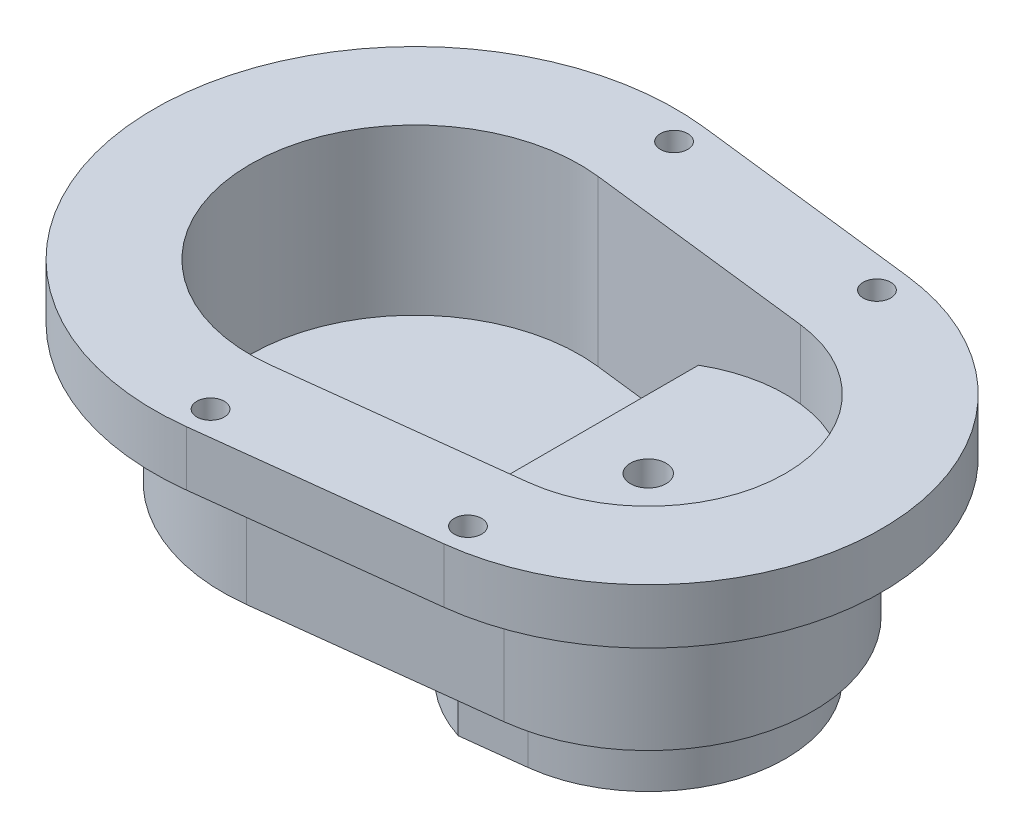
from build123d import *

# Parameters (mm, degrees)
EXTRUDE_2_DEPTH     = 70
CUT_EXTRUDE_1_DEPTH = 90
EXTRUDE_3_OUTLINE_R = 45
EXTRUDE_3_DEPTH     = 20
EXTRUDE_START       = -10
EXTRUDE_4_DEPTH     = 10
EXTRUDE_START_2     = -20
EXTRUDE_5_DEPTH     = 20
CUT_EXTRUDE_2_DEPTH = 207.942020866
EXTRUDE_START_3     = 35
SKETCH_13_R         = 50
EXTRUDE_6_DEPTH     = 35
CUT_EXTRUDE_START   = 15
CUT_EXTRUDE_3_DEPTH = 15
SKETCH_15_R         = 6.5
CUT_EXTRUDE_4_DEPTH = 207.942020866
CUT_EXTRUDE_5_REACH = 207.305


# Read off the part's stored shape, not the designer's step: 凸台-拉伸3
with BuildPart() as part:
    # 草图1 → 凸台-拉伸2 (new body)
    with BuildSketch(Plane(origin=(0, 0, 0), x_dir=(1, 0, 0), z_dir=(0, 1, 0))):
        with BuildLine():
            Line((8.235294118, 69.513883008), (92.058823529, 59.583328292))
            ThreePointArc((92.058823529, 59.583328292), (145, 0), (92.058823529, -59.583328292))
            Line((92.058823529, -59.583328292), (8.235294118, -69.513883008))
            ThreePointArc((8.235294118, -69.513883008), (-70, 0), (8.235294118, 69.513883008))
        make_face()
    extrude(amount=EXTRUDE_2_DEPTH)

    # 草图2 → 切除-拉伸1 (cut)
    with BuildSketch(Plane(origin=(0, 70, 0), x_dir=(1, 0, 0), z_dir=(0, 1, 0))):
        with BuildLine():
            Line((7.058823529, -59.583328292), (90.882352941, -49.652773577))
            ThreePointArc((90.882352941, -49.652773577), (135, 0), (90.882352941, 49.652773577))
            Line((90.882352941, 49.652773577), (7.058823529, 59.583328292))
            ThreePointArc((7.058823529, 59.583328292), (-60, 0), (7.058823529, -59.583328292))
        make_face()
    extrude(amount=-CUT_EXTRUDE_1_DEPTH, mode=Mode.SUBTRACT)



with BuildPart() as body_2:
    # 凸台-拉伸3 outline → 凸台-拉伸3 (new body)
    with BuildSketch(Plane.XZ):
        with BuildLine():
            ThreePointArc((90.882352941, -49.652773577), (135, 0), (90.882352941, 49.652773577))
            Line((90.882352941, 49.652773577), (68.128593603, 52.348406339))
            ThreePointArc((68.128593603, 52.348406339), (30, 0), (68.128593603, -52.348406339))
            Line((68.128593603, -52.348406339), (90.882352941, -49.652773577))
        make_face()
        with Locations((85, 0)):
            Circle(EXTRUDE_3_OUTLINE_R, mode=Mode.SUBTRACT)
    extrude(amount=EXTRUDE_3_DEPTH)


with BuildPart() as part_1:
    add(part.part)

    add(body_2.part)  # 凸台-拉伸4 merges body 2
    # 草图8 → 凸台-拉伸4 (add)
    with BuildSketch(Plane.XZ.offset(EXTRUDE_START)):
        with BuildLine():
            Line((90.882352941, -49.652773577), (7.058823529, -59.583328292))
            ThreePointArc((7.058823529, -59.583328292), (-60, 0), (7.058823529, 59.583328292))
            Line((7.058823529, 59.583328292), (90.882352941, 49.652773577))
            ThreePointArc((90.882352941, 49.652773577), (135, 0), (90.882352941, -49.652773577))
        make_face()
    extrude(amount=EXTRUDE_4_DEPTH)

    # 草图9 → 凸台-拉伸5 (add)
    with BuildSketch(Plane(origin=(0, 70, 0), x_dir=(1, 0, 0), z_dir=(0, 1, 0)).offset(EXTRUDE_START_2)):
        with BuildLine():
            Line((11.176470588, 94.340269796), (95, 84.409715081))
            ThreePointArc((95, 84.409715081), (170, 0), (95, -84.409715081))
            Line((95, -84.409715081), (11.176470588, -94.340269796))
            ThreePointArc((11.176470588, -94.340269796), (-95, 0), (11.176470588, 94.340269796))
        make_face()
        with BuildLine():
            Line((8.235294118, -69.513883008), (92.058823529, -59.583328292))
            ThreePointArc((92.058823529, -59.583328292), (145, 0), (92.058823529, 59.583328292))
            Line((92.058823529, 59.583328292), (8.235294118, 69.513883008))
            ThreePointArc((8.235294118, 69.513883008), (-70, 0), (8.235294118, -69.513883008))
        make_face(mode=Mode.SUBTRACT)
    extrude(amount=EXTRUDE_5_DEPTH)

    # 草图10 → 切除-拉伸2 (cut, through all)
    with BuildSketch(Plane.XZ.offset(-50)):
        with BuildLine():
            ThreePointArc((88.858252054, 75.067395659), (93.152609723, 69.524378153), (98.766439672, 73.725742714))
            ThreePointArc((98.766439672, 73.725742714), (96.301264767, 74.143653907), (93.823529412, 74.479160365))
            Line((93.823529412, 74.479160365), (88.858252054, 75.067395659))
        make_face()
        with BuildLine():
            ThreePointArc((93.823529412, 74.479160365), (96.301264767, 74.143653907), (98.766439672, 73.725742714))
            ThreePointArc((98.766439672, 73.725742714), (98.809236548, 74.101371603), (98.823529412, 74.479160365))
            ThreePointArc((98.823529412, 74.479160365), (94.11815902, 79.470472156), (88.858252054, 75.067395659))
            Line((88.858252054, 75.067395659), (93.823529412, 74.479160365))
        make_face()
        with BuildLine():
            ThreePointArc((88.858252054, 75.067395659), (93.152609723, 69.524378153), (98.766439672, 73.725742714))
            ThreePointArc((98.766439672, 73.725742714), (96.301264767, 74.143653907), (93.823529412, 74.479160365))
            Line((93.823529412, 74.479160365), (88.858252054, 75.067395659))
        make_face()
        with BuildLine():
            ThreePointArc((93.823529412, 74.479160365), (96.301264767, 74.143653907), (98.766439672, 73.725742714))
            ThreePointArc((98.766439672, 73.725742714), (98.809236548, 74.101371603), (98.823529412, 74.479160365))
            ThreePointArc((98.823529412, 74.479160365), (94.11815902, 79.470472156), (88.858252054, 75.067395659))
            Line((88.858252054, 75.067395659), (93.823529412, 74.479160365))
        make_face()
        with BuildLine():
            ThreePointArc((10, 84.409715081), (7.513035126, 84.667315436), (5.01956968, 84.851658323))
            ThreePointArc((5.01956968, 84.851658323), (9.484855013, 79.436323316), (14.965277358, 83.821479787))
            Line((14.965277358, 83.821479787), (10, 84.409715081))
        make_face()
        with BuildLine():
            ThreePointArc((15, 84.409715081), (10.221188156, 89.404820265), (5.01956968, 84.851658323))
            ThreePointArc((5.01956968, 84.851658323), (7.513035126, 84.667315436), (10, 84.409715081))
            Line((10, 84.409715081), (14.965277358, 83.821479787))
            ThreePointArc((14.965277358, 83.821479787), (14.991311791, 84.115085473), (15, 84.409715081))
        make_face()
        with BuildLine():
            ThreePointArc((10, 84.409715081), (7.513035126, 84.667315436), (5.01956968, 84.851658323))
            ThreePointArc((5.01956968, 84.851658323), (9.484855013, 79.436323316), (14.965277358, 83.821479787))
            Line((14.965277358, 83.821479787), (10, 84.409715081))
        make_face()
        with BuildLine():
            ThreePointArc((15, 84.409715081), (10.221188156, 89.404820265), (5.01956968, 84.851658323))
            ThreePointArc((5.01956968, 84.851658323), (7.513035126, 84.667315436), (10, 84.409715081))
            Line((10, 84.409715081), (14.965277358, 83.821479787))
            ThreePointArc((14.965277358, 83.821479787), (14.991311791, 84.115085473), (15, 84.409715081))
        make_face()
        with BuildLine():
            ThreePointArc((5.01956968, -84.851658323), (7.513035126, -84.667315436), (10, -84.409715081))
            Line((10, -84.409715081), (14.965277358, -83.821479787))
            ThreePointArc((14.965277358, -83.821479787), (9.484855013, -79.436323316), (5.01956968, -84.851658323))
        make_face()
        with BuildLine():
            Line((14.965277358, -83.821479787), (10, -84.409715081))
            ThreePointArc((10, -84.409715081), (7.513035126, -84.667315436), (5.01956968, -84.851658323))
            ThreePointArc((5.01956968, -84.851658323), (10.221188156, -89.404820265), (15, -84.409715081))
            ThreePointArc((15, -84.409715081), (14.991311791, -84.115085473), (14.965277358, -83.821479787))
        make_face()
        with BuildLine():
            ThreePointArc((5.01956968, -84.851658323), (7.513035126, -84.667315436), (10, -84.409715081))
            Line((10, -84.409715081), (14.965277358, -83.821479787))
            ThreePointArc((14.965277358, -83.821479787), (9.484855013, -79.436323316), (5.01956968, -84.851658323))
        make_face()
        with BuildLine():
            Line((14.965277358, -83.821479787), (10, -84.409715081))
            ThreePointArc((10, -84.409715081), (7.513035126, -84.667315436), (5.01956968, -84.851658323))
            ThreePointArc((5.01956968, -84.851658323), (10.221188156, -89.404820265), (15, -84.409715081))
            ThreePointArc((15, -84.409715081), (14.991311791, -84.115085473), (14.965277358, -83.821479787))
        make_face()
        with BuildLine():
            ThreePointArc((98.766439672, -73.725742714), (93.152609723, -69.524378153), (88.858252054, -75.067395659))
            Line((88.858252054, -75.067395659), (93.823529412, -74.479160365))
            ThreePointArc((93.823529412, -74.479160365), (96.301264767, -74.143653907), (98.766439672, -73.725742714))
        make_face()
        with BuildLine():
            Line((93.823529412, -74.479160365), (88.858252054, -75.067395659))
            ThreePointArc((88.858252054, -75.067395659), (94.11815902, -79.470472156), (98.823529412, -74.479160365))
            ThreePointArc((98.823529412, -74.479160365), (98.809236548, -74.101371603), (98.766439672, -73.725742714))
            ThreePointArc((98.766439672, -73.725742714), (96.301264767, -74.143653907), (93.823529412, -74.479160365))
        make_face()
        with BuildLine():
            ThreePointArc((98.766439672, -73.725742714), (93.152609723, -69.524378153), (88.858252054, -75.067395659))
            Line((88.858252054, -75.067395659), (93.823529412, -74.479160365))
            ThreePointArc((93.823529412, -74.479160365), (96.301264767, -74.143653907), (98.766439672, -73.725742714))
        make_face()
        with BuildLine():
            Line((93.823529412, -74.479160365), (88.858252054, -75.067395659))
            ThreePointArc((88.858252054, -75.067395659), (94.11815902, -79.470472156), (98.823529412, -74.479160365))
            ThreePointArc((98.823529412, -74.479160365), (98.809236548, -74.101371603), (98.766439672, -73.725742714))
            ThreePointArc((98.766439672, -73.725742714), (96.301264767, -74.143653907), (93.823529412, -74.479160365))
        make_face()
    extrude(amount=-CUT_EXTRUDE_2_DEPTH, mode=Mode.SUBTRACT)

    # 草图13 → 凸台-拉伸6 (add)
    with BuildSketch(Plane(origin=(0, 10, 0), x_dir=(1, 0, 0), z_dir=(0, 1, 0)).offset(EXTRUDE_START_3)):
        with Locations((85, 0)):
            Circle(SKETCH_13_R)
    extrude(amount=-EXTRUDE_6_DEPTH)

    # 草图14 → 切除-拉伸3 (cut)
    with BuildSketch(Plane(origin=(0, 10, 0), x_dir=(1, 0, 0), z_dir=(0, 1, 0)).offset(CUT_EXTRUDE_START)):
        with BuildLine():
            ThreePointArc((90.882352941, -49.652773577), (135, 0), (90.882352941, 49.652773577))
            ThreePointArc((90.882352941, 49.652773577), (35, 0), (90.882352941, -49.652773577))
        make_face()
    extrude(amount=-CUT_EXTRUDE_3_DEPTH, mode=Mode.SUBTRACT)

    # 草图15 → 切除-拉伸4 (cut, through all)
    with BuildSketch(Plane.XZ):
        with Locations(Location((85, 0, 0), (0, 0, 90))):
            Circle(SKETCH_15_R)
    extrude(amount=-CUT_EXTRUDE_4_DEPTH, mode=Mode.SUBTRACT)

    # 草图16 → 切除-拉伸5 (cut, up to next)
    with BuildSketch(Plane(origin=(0, 45, 0), x_dir=(1, 0, 0), z_dir=(0, 1, 0)), mode=Mode.PRIVATE) as cut_extrude_5_sk1:
        with BuildLine():
            Line((60, 0), (60, 43.301270189))
            ThreePointArc((60, 43.301270189), (41.698729811, 25), (35, 0))
            Line((35, 0), (60, 0))
        make_face()
    cut_extrude_5_tool1 = extrude(cut_extrude_5_sk1.sketch, amount=-CUT_EXTRUDE_5_REACH, mode=Mode.PRIVATE) & part_1.part
    # 草图16 → 切除-拉伸5 (cut, up to next)
    with BuildSketch(Plane(origin=(0, 45, 0), x_dir=(1, 0, 0), z_dir=(0, 1, 0)), mode=Mode.PRIVATE) as cut_extrude_5_sk2:
        with BuildLine():
            ThreePointArc((35, 0), (41.698729811, -25), (60, -43.301270189))
            Line((60, -43.301270189), (60, 0))
            Line((60, 0), (35, 0))
        make_face()
    cut_extrude_5_tool2 = extrude(cut_extrude_5_sk2.sketch, amount=-CUT_EXTRUDE_5_REACH, mode=Mode.PRIVATE) & part_1.part
    # 草图16 → 切除-拉伸5 (cut, up to next)
    with BuildSketch(Plane(origin=(0, 45, 0), x_dir=(1, 0, 0), z_dir=(0, 1, 0)), mode=Mode.PRIVATE) as cut_extrude_5_sk3:
        with BuildLine():
            Line((60, 0), (60, 43.301270189))
            ThreePointArc((60, 43.301270189), (41.698729811, 25), (35, 0))
            Line((35, 0), (60, 0))
        make_face()
    cut_extrude_5_tool3 = extrude(cut_extrude_5_sk3.sketch, amount=-CUT_EXTRUDE_5_REACH, mode=Mode.PRIVATE) & part_1.part
    # 草图16 → 切除-拉伸5 (cut, up to next)
    with BuildSketch(Plane(origin=(0, 45, 0), x_dir=(1, 0, 0), z_dir=(0, 1, 0)), mode=Mode.PRIVATE) as cut_extrude_5_sk4:
        with BuildLine():
            ThreePointArc((35, 0), (41.698729811, -25), (60, -43.301270189))
            Line((60, -43.301270189), (60, 0))
            Line((60, 0), (35, 0))
        make_face()
    cut_extrude_5_tool4 = extrude(cut_extrude_5_sk4.sketch, amount=-CUT_EXTRUDE_5_REACH, mode=Mode.PRIVATE) & part_1.part
    add(cut_extrude_5_tool1.solids().sort_by_distance((49.748992, 45, -16.960149))[0], mode=Mode.SUBTRACT)
    add(cut_extrude_5_tool2.solids().sort_by_distance((49.748992, 45, 16.960149))[0], mode=Mode.SUBTRACT)
    add(cut_extrude_5_tool3.solids().sort_by_distance((49.748992, 45, -16.960149))[0], mode=Mode.SUBTRACT)
    add(cut_extrude_5_tool4.solids().sort_by_distance((49.748992, 45, 16.960149))[0], mode=Mode.SUBTRACT)


solid = part_1.part
